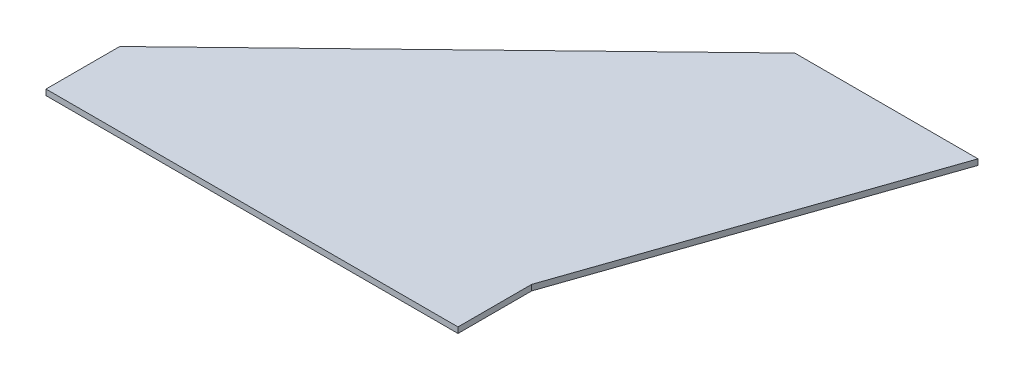
from build123d import *

# Parameters (mm, degrees)
BOSS_EXTRUDE1_DEPTH = 3.175


with BuildPart() as part:
    # Sketch1 → Boss-Extrude1 (new body)
    with BuildSketch(Plane(origin=(0, 0, 0), x_dir=(1, 0, 0), z_dir=(0, 1, 0))):
        Polygon((228.6, 0), (228.6, 40.894), (292.1, 225.044), (190.5, 225.044), (0, 40.894), (0, 0), align=None)
    extrude(amount=BOSS_EXTRUDE1_DEPTH)


solid = part.part
